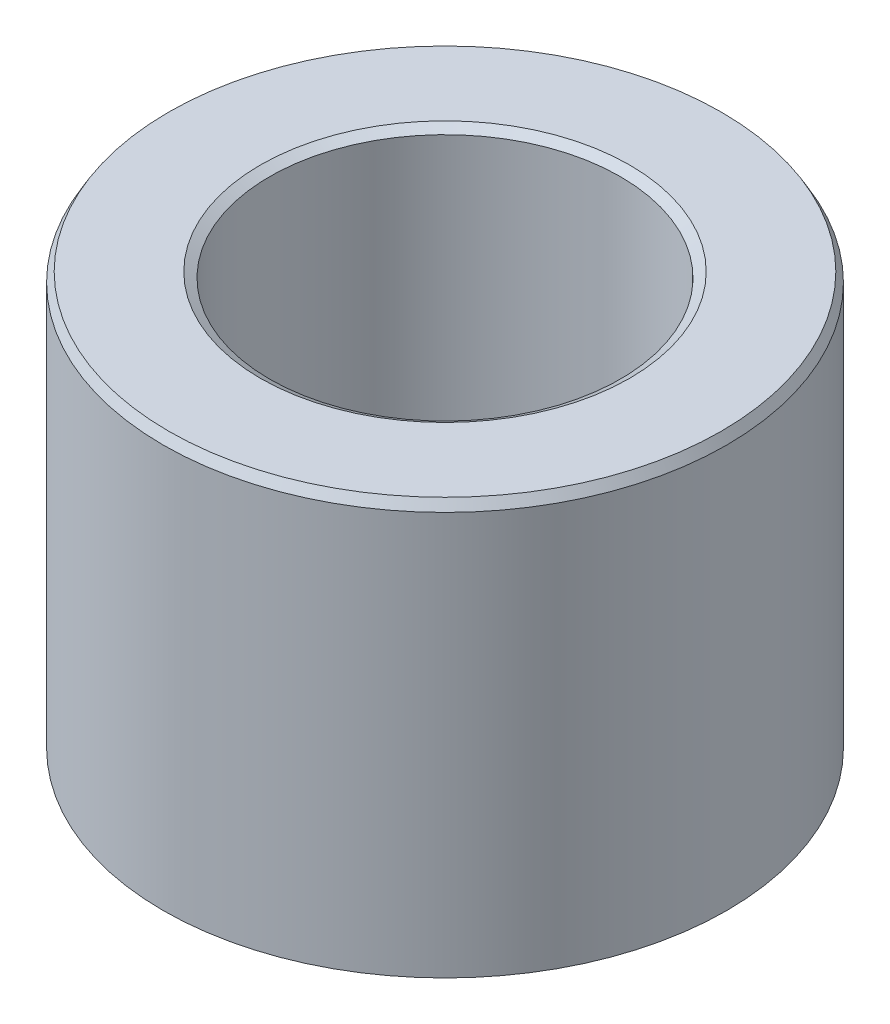
from build123d import *
from OCP.BRepFilletAPI import BRepFilletAPI_MakeChamfer

# Parameters (mm, degrees)
SKETCH1_R           = 47.5
BOSS_EXTRUDE1_DEPTH = 70.450516917
SKETCH2_R           = 29.57144774
CUT_EXTRUDE1_DEPTH  = 98.343594211
CHAMFER1_SIZE       = 1.57072292
CHAMFER1_SIZE2      = 0.906857301


with BuildPart() as part:
    # Sketch1 → Boss-Extrude1 (new body)
    with BuildSketch(Plane(origin=(0, 0, 0), x_dir=(1, 0, 0), z_dir=(0, 1, 0))):
        Circle(SKETCH1_R)
    extrude(amount=BOSS_EXTRUDE1_DEPTH)

    # Sketch2 → Cut-Extrude1 (cut, through all)
    with BuildSketch(Plane(origin=(0, 0, 0), x_dir=(1, 0, 0), z_dir=(0, 1, 0))):
        Circle(SKETCH2_R)
    extrude(amount=CUT_EXTRUDE1_DEPTH, mode=Mode.SUBTRACT)

    # Chamfer1: one chamfer whose edges measure the first distance from different faces: ONE call of the kernel's chamfer builder (chamfer() names one face for all edges)
    chamfer1_edges_1 = [part.edges().sort_by_distance(p)[0] for p in [
        (-29.57144774, 70.450516917, 0),
    ]]
    chamfer1_side_1 = [part.faces().sort_by_distance(p)[0] for p in [
        (-46.156497116, 70.450516917, 0),
    ]]
    chamfer1_edges_2 = [part.edges().sort_by_distance(p)[0] for p in [
        (-29.57144774, 0, 0),
    ]]
    chamfer1_side_2 = [part.faces().sort_by_distance(p)[0] for p in [
        (-29.57144774, 35.225258458, 0),
    ]]
    chamfer1_edges_3 = [part.edges().sort_by_distance(p)[0] for p in [
        (-47.5, 0, 0),
    ]]
    chamfer1_side_3 = [part.faces().sort_by_distance(p)[0] for p in [
        (-46.156497116, 0, 0),
    ]]
    chamfer1_edges_4 = [part.edges().sort_by_distance(p)[0] for p in [
        (-47.5, 70.450516917, 0),
    ]]
    chamfer1_side_4 = [part.faces().sort_by_distance(p)[0] for p in [
        (-47.5, 35.225258458, 0),
    ]]
    chamfer1 = BRepFilletAPI_MakeChamfer(part.part.solid().wrapped)
    for e in chamfer1_edges_1:
        chamfer1.Add(CHAMFER1_SIZE, CHAMFER1_SIZE2, e.wrapped, chamfer1_side_1[0].wrapped)  # the first distance lies on this face
    for e in chamfer1_edges_2:
        chamfer1.Add(CHAMFER1_SIZE, CHAMFER1_SIZE2, e.wrapped, chamfer1_side_2[0].wrapped)  # the first distance lies on this face
    for e in chamfer1_edges_3:
        chamfer1.Add(CHAMFER1_SIZE, CHAMFER1_SIZE2, e.wrapped, chamfer1_side_3[0].wrapped)  # the first distance lies on this face
    for e in chamfer1_edges_4:
        chamfer1.Add(CHAMFER1_SIZE, CHAMFER1_SIZE2, e.wrapped, chamfer1_side_4[0].wrapped)  # the first distance lies on this face
    add(Compound.cast(chamfer1.Shape()), mode=Mode.REPLACE)


solid = part.part
